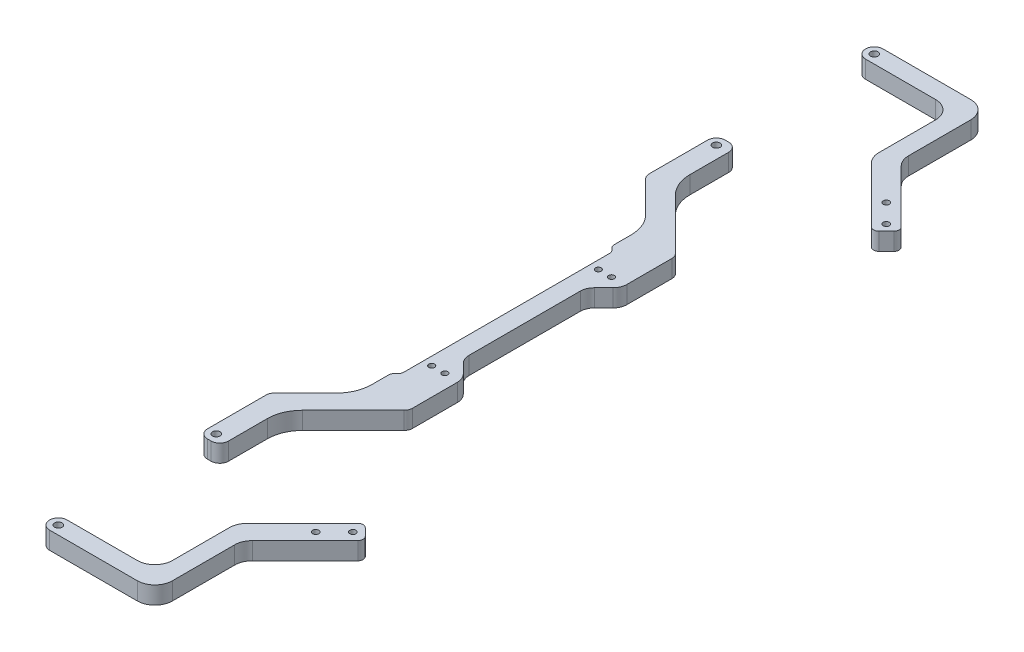
from build123d import *

# Parameters (mm, degrees)
SKETCH_1_R                 = 110
EXTRUDE_1_DEPTH            = 3
SKETCH_2_W                 = 110
SKETCH_2_H                 = 98
CUT_EXTRUDE_1_DEPTH        = 10
SKETCH_3_W                 = 11
SKETCH_3_H                 = 90
CUT_EXTRUDE_2_DEPTH        = 10
SKETCH_4_W                 = 28
SKETCH_4_H                 = 30
CUT_EXTRUDE_3_DEPTH        = 10
FILLET_1_R                 = 2
SKETCH_5_R                 = 2.65
SKETCH_5_R_2               = 1.65
CUT_EXTRUDE_4_DEPTH        = 10
SKETCH_6_W                 = 135
SKETCH_6_H                 = 32
SKETCH_6_W_2               = 32
SKETCH_6_H_2               = 135
CUT_EXTRUDE_5_DEPTH        = 313.909132177
SKETCH_7_W                 = 29
SKETCH_7_H                 = 130
CUT_EXTRUDE_6_DEPTH        = 10
EXTRUDE_2_DEPTH            = 3
SKETCH_12_R                = 1.65
CUT_EXTRUDE_7_DEPTH        = 112
CUT_EXTRUDE_1_2_DEPTH      = 304.514826656
CUT_EXTRUDE_1_2_DEPTH_BACK = 304.514826656
SKETCH_13_W                = 410.5
SKETCH_13_H                = 2
CUT_EXTRUDE_2_2_DEPTH      = 304.514826656
CUT_EXTRUDE_2_2_DEPTH_BACK = 304.514826656
SKETCH_14_W                = 2
SKETCH_14_H                = 410.5
FILLET_2_R                 = 3
FILLET_3_R                 = 3
FILLET_4_R                 = 3
FILLET_5_R                 = 3
FILLET_6_R                 = 3
SKETCH_15_R                = 1.75
CUT_EXTRUDE_8_DEPTH        = 10
SKETCH_16_R                = 1.65
SKETCH_16_R_2              = 2.15
CUT_EXTRUDE_9_DEPTH        = 10
SKETCH_18_R                = 1.65
EXTRUDE_3_DEPTH            = 10
CUT_EXTRUDE_10_DEPTH       = 473.618160963
CUT_EXTRUDE_10_DEPTH_BACK  = 473.618160963
SKETCH_19_W                = 530
SKETCH_19_H                = 40
SKETCH_20_R                = 1.65
EXTRUDE_4_DEPTH            = 10
EXTRUDE_6_DEPTH            = 10
CUT_EXTRUDE_12_DEPTH       = 317.908373021
FILLET_7_R                 = 5
FILLET_8_R                 = 5
SKETCH_25_R                = 1.65
CUT_EXTRUDE_13_DEPTH       = 317.908373021
SKETCH_26_R                = 1.75
EXTRUDE_7_DEPTH            = 10
CUT_EXTRUDE_14_DEPTH       = 10
FILLET_9_R                 = 10
FILLET_13_R                = 20
FILLET_14_R                = 20
CUT_EXTRUDE_16_DEPTH       = 317.908373021
FILLET_15_R                = 8
CUT_EXTRUDE_17_DEPTH       = 317.908373021
FILLET_16_R                = 3
SKETCH_32_W                = 17
SKETCH_32_H                = 60
CUT_EXTRUDE_18_DEPTH       = 317.908373021
FILLET_17_R                = 5
FILLET_18_R                = 5
FILLET_19_R                = 5
SKETCH_33_R                = 2.15
CUT_EXTRUDE_19_DEPTH       = 317.908373021
SKETCH_34_R                = 2.15
EXTRUDE_8_DEPTH            = 10
CUT_EXTRUDE_20_DEPTH       = 10
CUT_EXTRUDE_21_DEPTH       = 10
EXTRUDE_9_DEPTH            = 10
SKETCH_38_R                = 2.15
CUT_EXTRUDE_22_DEPTH       = 10


# Some blends are built 0.0001 mm under size
with BuildPart() as part:
    # 草图1 → 凸台-拉伸1 (new body)
    with BuildSketch(Plane(origin=(0, 0, 0), x_dir=(1, 0, 0), z_dir=(0, 1, 0))):
        Polygon((221.25, -67.5), (221.25, 67.5), (201.200576851, 67.5), (67.5, 201.200576851), (67.5, 221.25), (-67.5, 221.25), (-67.5, 201.200576851), (-201.200576851, 67.5), (-221.25, 67.5), (-221.25, -67.5), (-201.200576851, -67.5), (-67.5, -201.200576851), (-67.5, -221.25), (67.5, -221.25), (67.5, -201.200576851), (201.200576851, -67.5), align=None)
        with Locations(Location((0, 0, 0), (0, 0, 270))):
            Circle(SKETCH_1_R, mode=Mode.SUBTRACT)
    extrude(amount=EXTRUDE_1_DEPTH)

    # 草图2 → Cut-Extrude 1 (cut)
    with BuildSketch(Plane(origin=(0, 3, 0), x_dir=(1, 0, 0), z_dir=(0, 1, 0))):
        with Locations((0, -119)):
            Rectangle(SKETCH_2_W, SKETCH_2_H)
    extrude(amount=-CUT_EXTRUDE_1_DEPTH, mode=Mode.SUBTRACT)

    # 草图3 → Cut-Extrude 2 (cut)
    with BuildSketch(Plane(origin=(0, 3, 0), x_dir=(1, 0, 0), z_dir=(0, 1, 0))):
        with Locations((60.5, -123)):
            Rectangle(SKETCH_3_W, SKETCH_3_H)
    extrude(amount=-CUT_EXTRUDE_2_DEPTH, mode=Mode.SUBTRACT)

    # 草图4 → 切除-拉伸3 (cut)
    with BuildSketch(Plane(origin=(0, 3, 0), x_dir=(1, 0, 0), z_dir=(0, 1, 0))):
        with Locations((10, -168)):
            Rectangle(SKETCH_4_W, SKETCH_4_H)
    extrude(amount=-CUT_EXTRUDE_3_DEPTH, mode=Mode.SUBTRACT)

    # 圆角1
    fillet_1_edges = [part.edges().sort_by_distance(p)[0] for p in [
        (-4, 1.5, 183),
        (221.25, 1.5, -67.5),
        (221.25, 1.5, 67.5),
        (201.200576851, 1.5, 67.5),
        (67.5, 1.5, 201.200576851),
        (67.5, 1.5, 221.25),
        (-67.5, 1.5, 221.25),
        (-67.5, 1.5, 201.200576851),
        (-201.200576851, 1.5, 67.5),
        (-221.25, 1.5, 67.5),
        (-221.25, 1.5, -67.5),
        (-201.200576851, 1.5, -67.5),
        (-67.5, 1.5, -201.200576851),
        (-67.5, 1.5, -221.25),
        (67.5, 1.5, -221.25),
        (67.5, 1.5, -201.200576851),
        (201.200576851, 1.5, -67.5),
        (-55, 1.5, 95.262794416),
        (-55, 1.5, 168),
        (66, 1.5, 88),
        (66, 1.5, 168),
        (-4, 1.5, 168),
        (24, 1.5, 168),
        (24, 1.5, 183),
    ]]
    fillet(fillet_1_edges, radius=FILLET_1_R)

    # 草图5 → 切除-拉伸4 (cut)
    with BuildSketch(Plane(origin=(0, 3, 0), x_dir=(1, 0, 0), z_dir=(0, 1, 0))):
        with Locations(Location((-208.25, 47.5, 0), (0, 0, 270))):
            Circle(SKETCH_5_R)
        with Locations(Location((-197.5, 47.5, 0), (0, 0, 270))):
            Circle(SKETCH_5_R_2)
        with Locations(Location((-190, 47.5, 0), (0, 0, 270))):
            Circle(SKETCH_5_R_2)
        with Locations(Location((-190, -47.5, 0), (0, 0, 270))):
            Circle(SKETCH_5_R_2)
        with Locations(Location((-197.5, -47.5, 0), (0, 0, 270))):
            Circle(SKETCH_5_R_2)
        with Locations(Location((-208.25, -47.5, 0), (0, 0, 270))):
            Circle(SKETCH_5_R)
        with Locations(Location((47.5, 190, 0), (0, 0, 270))):
            Circle(SKETCH_5_R_2)
        with Locations(Location((47.5, 197.5, 0), (0, 0, 270))):
            Circle(SKETCH_5_R_2)
        with Locations(Location((47.5, 208.25, 0), (0, 0, 270))):
            Circle(SKETCH_5_R)
        with Locations(Location((-47.5, 208.25, 0), (0, 0, 270))):
            Circle(SKETCH_5_R)
        with Locations(Location((-47.5, 197.5, 0), (0, 0, 270))):
            Circle(SKETCH_5_R_2)
        with Locations(Location((-47.5, 190, 0), (0, 0, 270))):
            Circle(SKETCH_5_R_2)
        with Locations(Location((190, -47.5, 0), (0, 0, 270))):
            Circle(SKETCH_5_R_2)
        with Locations(Location((197.5, -47.5, 0), (0, 0, 270))):
            Circle(SKETCH_5_R_2)
        with Locations(Location((208.25, -47.5, 0), (0, 0, 270))):
            Circle(SKETCH_5_R)
        with Locations(Location((208.25, 47.5, 0), (0, 0, 270))):
            Circle(SKETCH_5_R)
        with Locations(Location((197.5, 47.5, 0), (0, 0, 270))):
            Circle(SKETCH_5_R_2)
        with Locations(Location((190, 47.5, 0), (0, 0, 270))):
            Circle(SKETCH_5_R_2)
        with Locations(Location((-47.5, -190, 0), (0, 0, 270))):
            Circle(SKETCH_5_R_2)
        with Locations(Location((-47.5, -197.5, 0), (0, 0, 270))):
            Circle(SKETCH_5_R_2)
        with Locations(Location((-47.5, -208.25, 0), (0, 0, 270))):
            Circle(SKETCH_5_R)
        with Locations(Location((47.5, -208.25, 0), (0, 0, 270))):
            Circle(SKETCH_5_R)
        with Locations(Location((47.5, -197.5, 0), (0, 0, 270))):
            Circle(SKETCH_5_R_2)
        with Locations(Location((47.5, -190, 0), (0, 0, 270))):
            Circle(SKETCH_5_R_2)
    extrude(amount=-CUT_EXTRUDE_4_DEPTH, mode=Mode.SUBTRACT)

    # 草图6 → 切除-拉伸5 (cut, through all)
    with BuildSketch(Plane(origin=(0, 3, 0), x_dir=(1, 0, 0), z_dir=(0, 1, 0))):
        with Locations((0, -221.25)):
            Rectangle(SKETCH_6_W, SKETCH_6_H)
        with Locations((-221.25, 0)):
            Rectangle(SKETCH_6_W_2, SKETCH_6_H_2)
        with Locations((221.25, 0)):
            Rectangle(SKETCH_6_W_2, SKETCH_6_H_2)
        with Locations((0, 221.25)):
            Rectangle(SKETCH_6_W, SKETCH_6_H)
    extrude(amount=-CUT_EXTRUDE_5_DEPTH, mode=Mode.SUBTRACT)

    # 草图7 → 切除-拉伸6 (cut)
    with BuildSketch(Plane(origin=(0, 3, 0), x_dir=(1, 0, 0), z_dir=(0, 1, 0))):
        with Locations((155, 0)):
            Rectangle(SKETCH_7_W, SKETCH_7_H)
    extrude(amount=-CUT_EXTRUDE_6_DEPTH, mode=Mode.SUBTRACT)

    # 草图8 → 凸台-拉伸2 (add)
    with BuildSketch(Plane(origin=(0, 3, 0), x_dir=(1, 0, 0), z_dir=(0, 1, 0))):
        Polygon((110.662211256, -214.60690809), (214.60690809, -110.662211256), (199.511809131, -69.18876772), (69.18876772, -199.511809131), align=None)
        Polygon((214.60690809, 110.662211256), (199.511809131, 69.18876772), (69.18876772, 199.511809131), (110.662211256, 214.60690809), align=None)
        Polygon((-214.60690809, -110.662211256), (-199.511809131, -69.18876772), (-69.18876772, -199.511809131), (-110.662211256, -214.60690809), align=None)
        Polygon((-110.662211256, 214.60690809), (-214.60690809, 110.662211256), (-199.511809131, 69.18876772), (-69.18876772, 199.511809131), align=None)
    extrude(amount=-EXTRUDE_2_DEPTH)

    # 草图12 → 切除-拉伸7 (cut)
    with BuildSketch(Plane(origin=(0, 3, 0), x_dir=(1, 0, 0), z_dir=(0, 1, 0))):
        with Locations(Location((162.634559673, -148.492424049, 0), (0, 0, 270))):
            Circle(SKETCH_12_R)
        with Locations(Location((152.027957955, -137.885822331, 0), (0, 0, 270))):
            Circle(SKETCH_12_R)
        with Locations(Location((137.885822331, -152.027957955, 0), (0, 0, 270))):
            Circle(SKETCH_12_R)
        with Locations(Location((148.492424049, -162.634559673, 0), (0, 0, 270))):
            Circle(SKETCH_12_R)
        with Locations(Location((148.492424049, 162.634559673, 0), (0, 0, 270))):
            Circle(SKETCH_12_R)
        with Locations(Location((137.885822331, 152.027957955, 0), (0, 0, 270))):
            Circle(SKETCH_12_R)
        with Locations(Location((152.027957955, 137.885822331, 0), (0, 0, 270))):
            Circle(SKETCH_12_R)
        with Locations(Location((162.634559673, 148.492424049, 0), (0, 0, 270))):
            Circle(SKETCH_12_R)
        with Locations(Location((-148.492424049, -162.634559673, 0), (0, 0, 270))):
            Circle(SKETCH_12_R)
        with Locations(Location((-137.885822331, -152.027957955, 0), (0, 0, 270))):
            Circle(SKETCH_12_R)
        with Locations(Location((-152.027957955, -137.885822331, 0), (0, 0, 270))):
            Circle(SKETCH_12_R)
        with Locations(Location((-162.634559673, -148.492424049, 0), (0, 0, 270))):
            Circle(SKETCH_12_R)
        with Locations(Location((-162.634559673, 148.492424049, 0), (0, 0, 270))):
            Circle(SKETCH_12_R)
        with Locations(Location((-152.027957955, 137.885822331, 0), (0, 0, 270))):
            Circle(SKETCH_12_R)
        with Locations(Location((-137.885822331, 152.027957955, 0), (0, 0, 270))):
            Circle(SKETCH_12_R)
        with Locations(Location((-148.492424049, 162.634559673, 0), (0, 0, 270))):
            Circle(SKETCH_12_R)
    extrude(amount=-CUT_EXTRUDE_7_DEPTH, mode=Mode.SUBTRACT)

    # 草图13 → Cut-Extrude 1 2 (cut, two sides: drawn at the far end of the back side and taken through both)
    with BuildSketch(Plane(origin=(0, 3, 0), x_dir=(1, 0, 0), z_dir=(0, 1, 0)).offset(-CUT_EXTRUDE_1_2_DEPTH_BACK)):
        Rectangle(SKETCH_13_W, SKETCH_13_H)
    extrude(amount=CUT_EXTRUDE_1_2_DEPTH + CUT_EXTRUDE_1_2_DEPTH_BACK, mode=Mode.SUBTRACT)


with BuildPart() as cut_extrude_1_2_piece_1:
    # of the separate pieces the step leaves, piece 1, a body of its own (cut_extrude_1_2_pieces)
    add(part.part.solids().sort_by_distance((169.5, 0, -1))[0])


with BuildPart() as cut_extrude_1_2_piece_2:
    # of the separate pieces the step leaves, piece 2, a body of its own (cut_extrude_1_2_pieces)
    add(part.part.solids().sort_by_distance((202.029003976, 0, 67.5))[0])


with BuildPart() as cut_extrude_2_2_tool:
    # 草图14 → Cut-Extrude 2 2 (new, two sides: drawn at the far end of the back side and taken through both)
    with BuildSketch(Plane(origin=(0, 3, 0), x_dir=(1, 0, 0), z_dir=(0, 1, 0)).offset(-CUT_EXTRUDE_2_2_DEPTH_BACK)):
        Rectangle(SKETCH_14_W, SKETCH_14_H)
    extrude(amount=CUT_EXTRUDE_2_2_DEPTH + CUT_EXTRUDE_2_2_DEPTH_BACK)


with BuildPart() as cut_extrude_1_2_piece_1_1:
    add(cut_extrude_1_2_piece_1.part)

    # Cut-Extrude 2 2: cut by cut_extrude_2_2_tool
    add(cut_extrude_2_2_tool.part, mode=Mode.SUBTRACT)


with BuildPart() as cut_extrude_1_2_piece_2_1:
    add(cut_extrude_1_2_piece_2.part)

    # Cut-Extrude 2 2: cut by cut_extrude_2_2_tool
    add(cut_extrude_2_2_tool.part, mode=Mode.SUBTRACT)


with BuildPart() as cut_extrude_2_2_piece_1:
    # of the separate pieces the step leaves, piece 1, a body of its own (cut_extrude_2_2_pieces)
    add(cut_extrude_1_2_piece_1_1.part.solids().sort_by_distance((-1, 0, -109.995454452))[0])

    # 圆角5
    # the kernel refuses this fillet: 3 mm, written as the material it adds along each edge
    with BuildSketch(Plane(origin=(-69.18876772, 3, -199.511809131), x_dir=(-0.9396926207859093, 0, -0.3420201433256662), z_dir=(0, -1, 0))) as fillet_5_piece_1:
        with BuildLine():
            CenterArc((1.887083369, 3), FILLET_5_R, 211.922044532, 58.077955468)
            Line((-0.659221556, 1.413705188), (0, 0))
            Line((0, 0), (1.887083369, 0))
        make_face()
    extrude(amount=3)
    with BuildSketch(Plane(origin=(-199.511809131, 3, -69.18876772), x_dir=(-0.7071067811865065, 0, 0.7071067811865885), z_dir=(0, -1, 0))) as fillet_5_piece_2:
        with BuildLine():
            CenterArc((1.921407468, 2.978133138), FILLET_5_R, 205, 58.077955468)
            Line((-0.797515893, 1.710278352), (0, 0))
            Line((0, 0), (1.559851089, 0))
        make_face()
    extrude(amount=3)
    # the kernel refuses this fillet: 3 mm, written as the material it takes off along each edge
    with BuildSketch(Plane(origin=(-67.5, 10.5, -205.25), x_dir=(0, 0, 1), z_dir=(0, -1, 0)), Plane(origin=(-205.25, 10.5, -67.5), x_dir=(0, 0, 1), z_dir=(0, -1, 0)), Plane(origin=(-205.25, 10.5, -1), x_dir=(1, 0, 0), z_dir=(0, -1, 0)), Plane(origin=(-1, 10.5, -205.25), x_dir=(-1, 0, 0), z_dir=(0, -1, 0))) as fillet_5_2_piece_1:
        with BuildLine():
            CenterArc((FILLET_5_R, -FILLET_5_R), FILLET_5_R, 90, 90)
            Line((0, -FILLET_5_R), (0, 0))
            Line((0, 0), (FILLET_5_R, 0))
        make_face()
    extrude(amount=18, mode=Mode.SUBTRACT)
    with BuildSketch(Plane(origin=(-110.662211256, 7.778026956, -214.60690809), x_dir=(-0.7071067811865476, 0, 0.7071067811865476), z_dir=(0, -1, 0)), Plane(origin=(-214.60690809, 7.778026956, -110.662211256), x_dir=(0.34202014332566893, 0, 0.9396926207859083), z_dir=(0, -1, 0))) as fillet_5_2_piece_2:
        with BuildLine():
            CenterArc((FILLET_5_R * 0.637070260807, -FILLET_5_R), FILLET_5_R, 90, 65)
            Line((-FILLET_5_R * 0.269237526229, -FILLET_5_R * 0.577381738259), (0, 0))
            Line((0, 0), (FILLET_5_R * 0.637070260807, 0))
        make_face()
    extrude(amount=12.556053912, mode=Mode.SUBTRACT)
    with BuildSketch(Plane(origin=(-109.995454452, 10.334317242, -1), x_dir=(0.022246495156751204, 0, -0.9997525161024806), z_dir=(0, -1, 0))) as fillet_5_2_piece_3:
        with BuildLine():
            CenterArc((2.933992407, -2.999740332), FILLET_5_R, 90.753857544, 87.971407014)
            Line((-0.065265141, -2.933000847), (0, 0))
            ThreePointArc((0, 0), (1.447260829, -0.009521157), (2.894521657, 0))
        make_face()
    extrude(amount=17.668634484, mode=Mode.SUBTRACT)
    with BuildSketch(Plane(origin=(-1, 10.334317242, -109.995454452), x_dir=(-0.9997525161024806, 0, 0.02224649515675109), z_dir=(0, -1, 0))) as fillet_5_2_piece_4:
        with BuildLine():
            CenterArc((2.933992407, 2.999740332), FILLET_5_R, 181.274735442, 87.971407014)
            Line((-0.065265141, 2.933000847), (0, 0))
            ThreePointArc((0, 0), (1.447260829, 0.009521157), (2.894521657, 0))
        make_face()
    extrude(amount=17.668634484, mode=Mode.SUBTRACT)


with BuildPart() as cut_extrude_2_2_piece_2:
    # of the separate pieces the step leaves, piece 2, a body of its own (cut_extrude_2_2_pieces)
    add(cut_extrude_1_2_piece_1_1.part.solids().sort_by_distance((169.5, 0, -65))[0])

    # 圆角4
    # the kernel refuses this fillet: 3 mm, written as the material it adds along each edge
    with BuildSketch(Plane(origin=(69.18876772, 3, -199.511809131), x_dir=(-0.7071067811865521, 0, -0.7071067811865429), z_dir=(0, -1, 0))) as fillet_4_piece_1:
        with BuildLine():
            CenterArc((1.921407468, 2.978133138), FILLET_4_R, 205, 58.077955468)
            Line((-0.797515893, 1.710278352), (0, 0))
            Line((0, 0), (1.559851089, 0))
        make_face()
    extrude(amount=3)
    with BuildSketch(Plane(origin=(169.5, 3, -65), x_dir=(0, 0, 1), z_dir=(0, -1, 0)), Plane(origin=(140.5, 3, -65), x_dir=(1, 0, 0), z_dir=(0, -1, 0))) as fillet_4_piece_2:
        with BuildLine():
            CenterArc((FILLET_4_R, FILLET_4_R), FILLET_4_R, 180, 90)
            Line((0, FILLET_4_R), (0, 0))
            Line((0, 0), (FILLET_4_R, 0))
        make_face()
    extrude(amount=3)
    # the kernel refuses this fillet: 3 mm, written as the material it takes off along each edge
    with BuildSketch(Plane(origin=(1, 10.334317242, -109.995454452), x_dir=(0.9997525161024806, 0, 0.022246495156751034), z_dir=(0, -1, 0))) as fillet_4_2_piece_1:
        with BuildLine():
            CenterArc((2.933992407, -2.999740332), FILLET_4_R, 90.753857544, 87.971407014)
            Line((-0.065265141, -2.933000847), (0, 0))
            ThreePointArc((0, 0), (1.447260829, -0.009521157), (2.894521657, 0))
        make_face()
    extrude(amount=17.668634484, mode=Mode.SUBTRACT)
    with BuildSketch(Plane(origin=(1, 10.5, -205.25), x_dir=(0, 0, 1), z_dir=(0, -1, 0)), Plane(origin=(67.5, 10.5, -205.25), x_dir=(-1, 0, 0), z_dir=(0, -1, 0)), Plane(origin=(205.25, 10.5, -67.5), x_dir=(-1, 0, 0), z_dir=(0, -1, 0)), Plane(origin=(140.5, 10.5, -1), x_dir=(0, 0, -1), z_dir=(0, -1, 0)), Plane(origin=(169.5, -7.5, -1), x_dir=(0, 0, -1), z_dir=(0, 1, 0))) as fillet_4_2_piece_2:
        with BuildLine():
            CenterArc((FILLET_4_R, -FILLET_4_R), FILLET_4_R, 90, 90)
            Line((0, -FILLET_4_R), (0, 0))
            Line((0, 0), (FILLET_4_R, 0))
        make_face()
    extrude(amount=18, mode=Mode.SUBTRACT)
    with BuildSketch(Plane(origin=(110.662211256, 7.778026956, -214.60690809), x_dir=(-0.9396926207859083, 0, 0.34202014332566893), z_dir=(0, -1, 0)), Plane(origin=(214.60690809, 7.778026956, -110.662211256), x_dir=(-0.7071067811865476, 0, -0.7071067811865476), z_dir=(0, -1, 0))) as fillet_4_2_piece_3:
        with BuildLine():
            CenterArc((FILLET_4_R * 0.637070260807, -FILLET_4_R), FILLET_4_R, 90, 65)
            Line((-FILLET_4_R * 0.269237526229, -FILLET_4_R * 0.577381738259), (0, 0))
            Line((0, 0), (FILLET_4_R * 0.637070260808, 0))
        make_face()
    extrude(amount=12.556053912, mode=Mode.SUBTRACT)
    with BuildSketch(Plane(origin=(109.995454452, 10.334317242, -1), x_dir=(1, 0, 0), z_dir=(0, -1, 0))) as fillet_4_2_piece_4:
        with BuildLine():
            CenterArc((2.933726897, -3), FILLET_4_R, 90, 87.971407014)
            ThreePointArc((-0.064392962, -2.89380531), (-0.02267768, -1.447114467), (0, 0))
            Line((0, 0), (2.933726897, 0))
        make_face()
    extrude(amount=17.668634484, mode=Mode.SUBTRACT)
    with BuildSketch(Plane(origin=(205.25, -7.5, -1), x_dir=(0, 0, -1), z_dir=(0, 1, 0))) as fillet_4_2_piece_5:
        with BuildLine():
            CenterArc((FILLET_4_R, FILLET_4_R), FILLET_4_R, 180, 90)
            Line((0, FILLET_4_R), (0, 0))
            Line((0, 0), (FILLET_4_R, 0))
        make_face()
    extrude(amount=18, mode=Mode.SUBTRACT)


with BuildPart() as cut_extrude_2_2_piece_1_of_cut_extrude_1:
    # of the separate pieces the step leaves, piece 1, a body of its own (cut_extrude_2_2_pieces_of_cut_extrude_1)
    add(cut_extrude_1_2_piece_2_1.part.solids().sort_by_distance((-1, 0, 205.25))[0])

    # 圆角2
    # the kernel refuses this fillet: 3 mm, written as the material it adds along each edge
    with BuildSketch(Plane(origin=(-69.18876772, 3, 199.511809131), x_dir=(0.7071067811865567, 0, 0.7071067811865385), z_dir=(0, -1, 0))) as fillet_2_piece_1:
        with BuildLine():
            CenterArc((1.921407468, 2.978133138), FILLET_2_R, 205, 58.077955468)
            Line((-0.797515893, 1.710278352), (0, 0))
            Line((0, 0), (1.559851089, 0))
        make_face()
    extrude(amount=3)
    with BuildSketch(Plane(origin=(-199.511809131, 3, 69.18876772), x_dir=(-0.34202014332567227, 0, 0.9396926207859071), z_dir=(0, -1, 0))) as fillet_2_piece_2:
        with BuildLine():
            CenterArc((1.887083369, 3), FILLET_2_R, 211.922044532, 58.077955468)
            Line((-0.659221556, 1.413705188), (0, 0))
            Line((0, 0), (1.887083369, 0))
        make_face()
    extrude(amount=3)
    # the kernel refuses this fillet: 3 mm, written as the material it takes off along each edge
    with BuildSketch(Plane(origin=(-1, -7.5, 205.25), x_dir=(-1, 0, 0), z_dir=(0, 1, 0)), Plane(origin=(-67.5, 10.5, 205.25), x_dir=(1, 0, 0), z_dir=(0, -1, 0)), Plane(origin=(-205.25, 10.5, 1), x_dir=(0, 0, 1), z_dir=(0, -1, 0)), Plane(origin=(-205.25, 10.5, 67.5), x_dir=(1, 0, 0), z_dir=(0, -1, 0))) as fillet_2_2_piece_1:
        with BuildLine():
            CenterArc((FILLET_2_R, -FILLET_2_R), FILLET_2_R, 90, 90)
            Line((0, -FILLET_2_R), (0, 0))
            Line((0, 0), (FILLET_2_R, 0))
        make_face()
    extrude(amount=18, mode=Mode.SUBTRACT)
    with BuildSketch(Plane(origin=(-214.60690809, 7.778026956, 110.662211256), x_dir=(0.7071067811865476, 0, 0.7071067811865476), z_dir=(0, -1, 0)), Plane(origin=(-110.662211256, 7.778026956, 214.60690809), x_dir=(0.9396926207859083, 0, -0.34202014332566893), z_dir=(0, -1, 0))) as fillet_2_2_piece_2:
        with BuildLine():
            CenterArc((FILLET_2_R * 0.637070260807, -FILLET_2_R), FILLET_2_R, 90, 65)
            Line((-FILLET_2_R * 0.269237526229, -FILLET_2_R * 0.577381738259), (0, 0))
            Line((0, 0), (FILLET_2_R * 0.637070260807, 0))
        make_face()
    extrude(amount=12.556053912, mode=Mode.SUBTRACT)

    # 圆角6
    fillet_6_edges = [cut_extrude_2_2_piece_1_of_cut_extrude_1.edges().sort_by_distance(p)[0] for p in [
        (-1, 1.5, 183),
        (-109.995454452, 1.5, 1),
    ]]
    fillet(fillet_6_edges, radius=FILLET_6_R)


with BuildPart() as cut_extrude_2_2_piece_2_of_cut_extrude_1:
    # of the separate pieces the step leaves, piece 2, a body of its own (cut_extrude_2_2_pieces_of_cut_extrude_1)
    add(cut_extrude_1_2_piece_2_1.part.solids().sort_by_distance((202.029003976, 0, 67.5))[0])

    # 圆角3
    # the kernel refuses this fillet: 3 mm, written as the material it adds along each edge
    with BuildSketch(Plane(origin=(169.5, 3, 65), x_dir=(-1, 0, 0), z_dir=(0, -1, 0)), Plane(origin=(140.5, 3, 65), x_dir=(0, 0, -1), z_dir=(0, -1, 0))) as fillet_3_piece_1:
        with BuildLine():
            CenterArc((FILLET_3_R, FILLET_3_R), FILLET_3_R, 180, 90)
            Line((0, FILLET_3_R), (0, 0))
            Line((0, 0), (FILLET_3_R, 0))
        make_face()
    extrude(amount=3)
    with BuildSketch(Plane(origin=(199.511809131, 3, 69.18876772), x_dir=(0.7071067811865385, 0, -0.7071067811865567), z_dir=(0, -1, 0))) as fillet_3_piece_2:
        with BuildLine():
            CenterArc((1.921407468, 2.978133138), FILLET_3_R, 205, 58.077955468)
            Line((-0.797515893, 1.710278352), (0, 0))
            Line((0, 0), (1.559851089, 0))
        make_face()
    extrude(amount=3)
    with BuildSketch(Plane(origin=(69.18876772, 3, 199.511809131), x_dir=(0.9396926207859093, 0, 0.3420201433256662), z_dir=(0, -1, 0))) as fillet_3_piece_3:
        with BuildLine():
            CenterArc((1.887083369, 3), FILLET_3_R, 211.922044532, 58.077955468)
            Line((-0.659221556, 1.413705188), (0, 0))
            Line((0, 0), (1.887083369, 0))
        make_face()
    extrude(amount=3)
    # the kernel refuses this fillet: 3 mm, written as the material it takes off along each edge
    with BuildSketch(Plane(origin=(109.995454452, 10.334317242, 1), x_dir=(-0.02224649515675097, 0, 0.9997525161024806), z_dir=(0, -1, 0))) as fillet_3_2_piece_1:
        with BuildLine():
            CenterArc((2.933992407, -2.999740332), FILLET_3_R, 90.753857544, 87.971407014)
            Line((-0.065265141, -2.933000847), (0, 0))
            ThreePointArc((0, 0), (1.447260829, -0.009521157), (2.894521657, 0))
        make_face()
    extrude(amount=17.668634484, mode=Mode.SUBTRACT)
    with BuildSketch(Plane(origin=(140.5, -7.5, 1), x_dir=(-1, 0, 0), z_dir=(0, 1, 0)), Plane(origin=(205.25, -7.5, 1), x_dir=(-1, 0, 0), z_dir=(0, 1, 0)), Plane(origin=(1, -7.5, 183), x_dir=(0, 0, 1), z_dir=(0, 1, 0)), Plane(origin=(1, -7.5, 205.25), x_dir=(1, 0, 0), z_dir=(0, 1, 0))) as fillet_3_2_piece_2:
        with BuildLine():
            CenterArc((FILLET_3_R, FILLET_3_R), FILLET_3_R, 180, 90)
            Line((0, FILLET_3_R), (0, 0))
            Line((0, 0), (FILLET_3_R, 0))
        make_face()
    extrude(amount=18, mode=Mode.SUBTRACT)
    with BuildSketch(Plane(origin=(169.5, 10.5, 1), x_dir=(0, 0, 1), z_dir=(0, -1, 0)), Plane(origin=(205.25, 10.5, 67.5), x_dir=(0, 0, -1), z_dir=(0, -1, 0)), Plane(origin=(67.5, 10.5, 205.25), x_dir=(0, 0, -1), z_dir=(0, -1, 0))) as fillet_3_2_piece_3:
        with BuildLine():
            CenterArc((FILLET_3_R, -FILLET_3_R), FILLET_3_R, 90, 90)
            Line((0, -FILLET_3_R), (0, 0))
            Line((0, 0), (FILLET_3_R, 0))
        make_face()
    extrude(amount=18, mode=Mode.SUBTRACT)
    with BuildSketch(Plane(origin=(214.60690809, 7.778026956, 110.662211256), x_dir=(-0.34202014332566893, 0, -0.9396926207859083), z_dir=(0, -1, 0)), Plane(origin=(110.662211256, 7.778026956, 214.60690809), x_dir=(0.7071067811865476, 0, -0.7071067811865476), z_dir=(0, -1, 0))) as fillet_3_2_piece_4:
        with BuildLine():
            CenterArc((FILLET_3_R * 0.637070260807, -FILLET_3_R), FILLET_3_R, 90, 65)
            Line((-FILLET_3_R * 0.269237526229, -FILLET_3_R * 0.577381738259), (0, 0))
            Line((0, 0), (FILLET_3_R * 0.637070260808, 0))
        make_face()
    extrude(amount=12.556053912, mode=Mode.SUBTRACT)


with BuildPart() as cut_extrude_8_tool:
    # 草图15 → 切除-拉伸8 (new body)
    with BuildSketch(Plane.XZ):
        with Locations(Location((106.066017178, -205.060966544, 0), (0, 0, 270))):
            Circle(SKETCH_15_R)
        with Locations(Location((91.923881554, -190.91883092, 0), (0, 0, 270))):
            Circle(SKETCH_15_R)
        with Locations(Location((190.91883092, -91.923881554, 0), (0, 0, 90))):
            Circle(SKETCH_15_R)
        with Locations(Location((205.060966544, -106.066017178, 0), (0, 0, 90))):
            Circle(SKETCH_15_R)
        with Locations(Location((-205.060966544, -106.066017178, 0), (0, 0, 270))):
            Circle(SKETCH_15_R)
        with Locations(Location((-190.91883092, -91.923881554, 0), (0, 0, 270))):
            Circle(SKETCH_15_R)
        with Locations(Location((-91.923881554, -190.91883092, 0), (0, 0, 90))):
            Circle(SKETCH_15_R)
        with Locations(Location((-106.066017178, -205.060966544, 0), (0, 0, 90))):
            Circle(SKETCH_15_R)
        with Locations(Location((-106.066017178, 205.060966544, 0), (0, 0, 270))):
            Circle(SKETCH_15_R)
        with Locations(Location((-91.923881554, 190.91883092, 0), (0, 0, 270))):
            Circle(SKETCH_15_R)
        with Locations(Location((-190.91883092, 91.923881554, 0), (0, 0, 90))):
            Circle(SKETCH_15_R)
        with Locations(Location((-205.060966544, 106.066017178, 0), (0, 0, 90))):
            Circle(SKETCH_15_R)
        with Locations(Location((205.060966544, 106.066017178, 0), (0, 0, 270))):
            Circle(SKETCH_15_R)
        with Locations(Location((190.91883092, 91.923881554, 0), (0, 0, 270))):
            Circle(SKETCH_15_R)
        with Locations(Location((91.923881554, 190.91883092, 0), (0, 0, 90))):
            Circle(SKETCH_15_R)
        with Locations(Location((106.066017178, 205.060966544, 0), (0, 0, 90))):
            Circle(SKETCH_15_R)
    extrude(amount=-CUT_EXTRUDE_8_DEPTH)


with BuildPart() as cut_extrude_2_2_piece_1_1:
    add(cut_extrude_2_2_piece_1.part)

    # 切除-拉伸8: cut by cut_extrude_8_tool
    add(cut_extrude_8_tool.part, mode=Mode.SUBTRACT)

    # 草图16 → 切除-拉伸9 (cut)
    with BuildSketch(Plane(origin=(0, 3, 0), x_dir=(1, 0, 0), z_dir=(0, 1, 0))):
        with Locations(Location((-118.793939239, 149.906637612, 0), (0, 0, 270))):
            Circle(SKETCH_16_R)
        with Locations(Location((-71.77133829, 117.733279068, 0), (0, 0, 270))):
            Circle(SKETCH_16_R_2)
        with Locations(Location((-117.733279068, 71.77133829, 0), (0, 0, 270))):
            Circle(SKETCH_16_R_2)
        with Locations(Location((-149.906637612, 118.793939239, 0), (0, 0, 270))):
            Circle(SKETCH_16_R)
    extrude(amount=-CUT_EXTRUDE_9_DEPTH, mode=Mode.SUBTRACT)



with BuildPart() as cut_extrude_2_2_piece_2_1:
    add(cut_extrude_2_2_piece_2.part)

    # 切除-拉伸8: cut by cut_extrude_8_tool
    add(cut_extrude_8_tool.part, mode=Mode.SUBTRACT)


with BuildPart() as cut_extrude_2_2_piece_1_of_cut_extrude_1_1:
    add(cut_extrude_2_2_piece_1_of_cut_extrude_1.part)

    # 切除-拉伸8: cut by cut_extrude_8_tool
    add(cut_extrude_8_tool.part, mode=Mode.SUBTRACT)


with BuildPart() as cut_extrude_2_2_piece_2_of_cut_extrude_1_1:
    add(cut_extrude_2_2_piece_2_of_cut_extrude_1.part)

    # 切除-拉伸8: cut by cut_extrude_8_tool
    add(cut_extrude_8_tool.part, mode=Mode.SUBTRACT)


with BuildPart() as cut_extrude_2_2_piece_1_2:
    add(cut_extrude_2_2_piece_1_1.part)

    add(cut_extrude_2_2_piece_1_of_cut_extrude_1_1.part)  # 凸台-拉伸3 merges Cut-Extrude 2 2 piece 1 of Cut-Extrude 1
    # 草图18 → 凸台-拉伸3 (add)
    with BuildSketch(Plane(origin=(0, 3, 0), x_dir=(1, 0, 0), z_dir=(0, 1, 0))):
        with BuildLine():
            Line((-182, -75.933982822), (-182, 75.933982822))
            Line((-182, 75.933982822), (-218.25, 112.183982822))
            Line((-218.25, 112.183982822), (-218.25, 188.379942315))
            ThreePointArc((-218.25, 188.379942315), (-216.398050297, 191.151580912), (-213.128679656, 190.501262658))
            Line((-213.128679656, 190.501262658), (-152.735064736, 130.107647738))
            Line((-152.735064736, 130.107647738), (-144.249783362, 138.592929113))
            Line((-144.249783362, 138.592929113), (-221.714466094, 216.057611845))
            ThreePointArc((-221.714466094, 216.057611845), (-227.163417162, 217.141475601), (-230.25, 212.522077939))
            Line((-230.25, 212.522077939), (-230.25, 107.213420074))
            Line((-230.25, 107.213420074), (-205.25, 82.213420074))
            Line((-205.25, 82.213420074), (-205.25, -82.213420074))
            Line((-205.25, -82.213420074), (-230.25, -107.213420074))
            Line((-230.25, -107.213420074), (-230.25, -212.522077939))
            ThreePointArc((-230.25, -212.522077939), (-227.163417162, -217.141475601), (-221.714466094, -216.057611845))
            Line((-221.714466094, -216.057611845), (-144.249783362, -138.592929113))
            Line((-144.249783362, -138.592929113), (-152.735064736, -130.107647738))
            Line((-152.735064736, -130.107647738), (-213.128679656, -190.501262658))
            ThreePointArc((-213.128679656, -190.501262658), (-216.398050297, -191.151580912), (-218.25, -188.379942315))
            Line((-218.25, -188.379942315), (-218.25, -112.183982822))
            Line((-218.25, -112.183982822), (-182, -75.933982822))
        make_face()
        with Locations(Location((-190, 47.5, 0), (0, 0, 270))):
            Circle(SKETCH_18_R, mode=Mode.SUBTRACT)
        with Locations(Location((-197.5, 47.5, 0), (0, 0, 270))):
            Circle(SKETCH_18_R, mode=Mode.SUBTRACT)
        with Locations(Location((-197.5, -47.5, 0), (0, 0, 270))):
            Circle(SKETCH_18_R, mode=Mode.SUBTRACT)
        with Locations(Location((-190, -47.5, 0), (0, 0, 270))):
            Circle(SKETCH_18_R, mode=Mode.SUBTRACT)
        with Locations(Location((-152.027957955, -137.885822331, 0), (0, 0, 270))):
            Circle(SKETCH_18_R, mode=Mode.SUBTRACT)
        with Locations(Location((-162.634559673, -148.492424049, 0), (0, 0, 270))):
            Circle(SKETCH_18_R, mode=Mode.SUBTRACT)
        with Locations(Location((-152.027957955, 137.885822331, 0), (0, 0, 270))):
            Circle(SKETCH_18_R, mode=Mode.SUBTRACT)
        with Locations(Location((-162.634559673, 148.492424049, 0), (0, 0, 270))):
            Circle(SKETCH_18_R, mode=Mode.SUBTRACT)
    extrude(amount=EXTRUDE_3_DEPTH)


with BuildPart() as cut_extrude_10_tool:
    # 草图19 → 切除-拉伸10 (new, two sides: drawn at the far end of the back side and taken through both)
    with BuildSketch(Plane.ZY.offset(205.25).offset(-CUT_EXTRUDE_10_DEPTH_BACK)):
        with Locations((19.540360843, -17)):
            Rectangle(SKETCH_19_W, SKETCH_19_H)
    extrude(amount=CUT_EXTRUDE_10_DEPTH + CUT_EXTRUDE_10_DEPTH_BACK)


with BuildPart() as cut_extrude_2_2_piece_1_3:
    add(cut_extrude_2_2_piece_1_2.part)

    # 切除-拉伸10: cut by cut_extrude_10_tool
    add(cut_extrude_10_tool.part, mode=Mode.SUBTRACT)

    # 草图20 → 凸台-拉伸4 (add)
    with BuildSketch(Plane(origin=(0, 13, 0), x_dir=(1, 0, 0), z_dir=(0, 1, 0))):
        with Locations((-152.027957955, 137.885822331)):
            Circle(SKETCH_20_R)
        with Locations((-162.634559673, 148.492424049)):
            Circle(SKETCH_20_R)
    extrude(amount=-EXTRUDE_4_DEPTH)

    # 草图23 → 凸台-拉伸6 (add)
    with BuildSketch(Plane(origin=(0, 13, 0), x_dir=(1, 0, 0), z_dir=(0, 1, 0))):
        with BuildLine():
            Line((-175.25, 217.522077939), (-225.25, 217.522077939))
            ThreePointArc((-225.25, 217.522077939), (-223.336582838, 217.141475601), (-221.714466094, 216.057611845))
            Line((-221.714466094, 216.057611845), (-213.178932188, 207.522077939))
            Line((-213.178932188, 207.522077939), (-185.25, 207.522077939))
            ThreePointArc((-185.25, 207.522077939), (-178.178932188, 204.593145751), (-175.25, 197.522077939))
            Line((-175.25, 197.522077939), (-175.25, 169.593145751))
            Line((-175.25, 169.593145751), (-165.25, 159.593145751))
            Line((-165.25, 159.593145751), (-165.25, 207.522077939))
            ThreePointArc((-165.25, 207.522077939), (-168.178932188, 214.593145751), (-175.25, 217.522077939))
        make_face()
    extrude_6 = extrude(amount=-EXTRUDE_6_DEPTH)

    # 草图24 → 切除-拉伸12 (cut, through all)
    with BuildSketch(Plane.XZ.offset(-3)):
        Polygon((-218.25, -188.379942315), (-218.25, -207.522077939), (-213.178932188, -207.522077939), (-175.25, -169.593145751), (-175.25, -152.622583002), align=None)
    cut_extrude_12 = extrude(amount=-CUT_EXTRUDE_12_DEPTH, mode=Mode.SUBTRACT)

    # 镜向1: 凸台-拉伸6, 切除-拉伸12 across plane
    add(extrude_6.mirror(Plane.XY))
    add(cut_extrude_12.mirror(Plane.XY), mode=Mode.SUBTRACT)

    # 圆角7
    fillet_7_edges = [cut_extrude_2_2_piece_1_3.edges().sort_by_distance(p)[0] for p in [
        (-218.25, 8, -207.522077939),
        (-218.25, 8, 207.522077939),
    ]]
    fillet(fillet_7_edges, radius=FILLET_7_R)

    # 圆角8
    fillet_8_edges = [cut_extrude_2_2_piece_1_3.edges().sort_by_distance(p)[0] for p in [
        (-230.25, 8, 107.213420074),
        (-144.249783362, 8, 138.592929113),
        (-152.735064736, 8, 130.107647738),
        (-182, 8, 75.933982822),
        (-182, 8, -75.933982822),
        (-152.735064736, 8, -130.107647738),
        (-144.249783362, 8, -138.592929113),
        (-230.25, 8, -107.213420074),
        (-175.25, 8, -152.622583002),
        (-175.25, 8, 152.622583002),
    ]]
    fillet(fillet_8_edges, radius=FILLET_8_R)

    # 草图25 → 切除-拉伸13 (cut, through all)
    with BuildSketch(Plane(origin=(0, 13, 0), x_dir=(1, 0, 0), z_dir=(0, 1, 0))):
        with Locations(Location((-152.027957955, 137.885822331, 0), (0, 0, 270))):
            Circle(SKETCH_25_R)
        with Locations(Location((-162.634559673, 148.492424049, 0), (0, 0, 270))):
            Circle(SKETCH_25_R)
    extrude(amount=-CUT_EXTRUDE_13_DEPTH, mode=Mode.SUBTRACT)

    # 草图26 → 凸台-拉伸7 (add)
    # profile 1 of 2: a face of its own
    with BuildSketch(Plane(origin=(0, 13, 0), x_dir=(1, 0, 0), z_dir=(0, 1, 0))):
        with BuildLine():
            Line((-140.714249456, 146.371103706), (-165.25, 170.906854249))
            Line((-165.25, 170.906854249), (-165.25, 187.877416998))
            Line((-165.25, 187.877416998), (-132.228968082, 154.85638508))
            ThreePointArc((-132.228968082, 154.85638508), (-131.350288425, 152.735064736), (-132.228968082, 150.613744393))
            Line((-132.228968082, 150.613744393), (-136.471608769, 146.371103706))
            ThreePointArc((-136.471608769, 146.371103706), (-138.592929113, 145.492424049), (-140.714249456, 146.371103706))
        make_face()
        with Locations(Location((-137.885822331, 152.027957955, 0), (0, 0, 270))):
            Circle(SKETCH_26_R, mode=Mode.SUBTRACT)
        with Locations(Location((-148.492424049, 162.634559673, 0), (0, 0, 270))):
            Circle(SKETCH_26_R, mode=Mode.SUBTRACT)
    # profile 2 of 2: a face of its own
    with BuildSketch(Plane(origin=(0, 13, 0), x_dir=(1, 0, 0), z_dir=(0, 1, 0))):
        with BuildLine():
            Line((-132.228968082, -154.85638508), (-165.25, -187.877416998))
            Line((-165.25, -187.877416998), (-165.25, -170.906854249))
            Line((-165.25, -170.906854249), (-140.714249456, -146.371103706))
            ThreePointArc((-140.714249456, -146.371103706), (-138.592929113, -145.492424049), (-136.471608769, -146.371103706))
            Line((-136.471608769, -146.371103706), (-132.228968082, -150.613744393))
            ThreePointArc((-132.228968082, -150.613744393), (-131.350288425, -152.735064736), (-132.228968082, -154.85638508))
        make_face()
        with Locations(Location((-148.492424049, -162.634559673, 0), (0, 0, 270))):
            Circle(SKETCH_26_R, mode=Mode.SUBTRACT)
        with Locations(Location((-137.885822331, -152.027957955, 0), (0, 0, 270))):
            Circle(SKETCH_26_R, mode=Mode.SUBTRACT)
    extrude(amount=-EXTRUDE_7_DEPTH)

    # 草图27 → 切除-拉伸14 (cut)
    with BuildSketch(Plane(origin=(0, 13, 0), x_dir=(1, 0, 0), z_dir=(0, 1, 0))):
        Polygon((-165.25, 170.906854249), (-175.25, 180.906854249), (-175.25, 129.543465188), (-140.778130248, 129.543465188), (-140.714249456, 146.371103706), align=None)
        Polygon((-140.714249456, -146.371103706), (-165.25, -170.906854249), (-175.25, -180.906854249), (-175.25, -129.543465188), (-140.778130248, -129.543465188), align=None)
    extrude(amount=-CUT_EXTRUDE_14_DEPTH, mode=Mode.SUBTRACT)

    # 圆角9
    fillet_9_edges = [cut_extrude_2_2_piece_1_3.edges().sort_by_distance(p)[0] for p in [
        (-165.25, 8, -187.877416998),
        (-165.25, 8, 187.877416998),
        (-175.25, 8, -180.906854249),
        (-175.25, 8, 180.906854249),
    ]]
    fillet(fillet_9_edges, radius=FILLET_9_R)

    # 圆角13
    fillet_13_edges = [cut_extrude_2_2_piece_1_3.edges().sort_by_distance(p)[0] for p in [
        (-205.25, 8, 82.213420074),
        (-218.25, 8, 112.183982822),
    ]]
    fillet(fillet_13_edges, radius=FILLET_13_R)

    # 圆角14
    fillet_14_edges = [cut_extrude_2_2_piece_1_3.edges().sort_by_distance(p)[0] for p in [
        (-205.25, 8, -82.213420074),
        (-218.25, 8, -112.183982822),
    ]]
    fillet(fillet_14_edges, radius=FILLET_14_R)

    # 草图30 → 切除-拉伸16 (cut, through all)
    with BuildSketch(Plane.XZ.offset(-3)):
        Polygon((-182, 45), (-192, 35), (-192, -35), (-182, -45), align=None)
    extrude(amount=-CUT_EXTRUDE_16_DEPTH, mode=Mode.SUBTRACT)

    # 圆角15
    fillet_15_edges = [cut_extrude_2_2_piece_1_3.edges().sort_by_distance(p)[0] for p in [
        (-182, 8, 45),
        (-182, 8, -45),
        (-192, 8, -35),
        (-192, 8, 35),
    ]]
    fillet(fillet_15_edges, radius=FILLET_15_R)

    # 草图31 → 切除-拉伸17 (cut, through all)
    with BuildSketch(Plane.XZ.offset(-3)):
        Polygon((-205.25, 63), (-202.25, 60), (-202.25, 0), (-202.25, -60), (-205.25, -63), align=None)
    extrude(amount=-CUT_EXTRUDE_17_DEPTH, mode=Mode.SUBTRACT)

    # 圆角16
    fillet_16_edges = [cut_extrude_2_2_piece_1_3.edges().sort_by_distance(p)[0] for p in [
        (-205.25, 8, -63),
        (-205.25, 8, 63),
        (-202.25, 8, 60),
        (-202.25, 8, -60),
    ]]
    fillet(fillet_16_edges, radius=FILLET_16_R)

    # 草图32 → 切除-拉伸18 (cut, through all)
    with BuildSketch(Plane.XZ.offset(-3)):
        with Locations((-221.75, 177.522077939)):
            Rectangle(SKETCH_32_W, SKETCH_32_H)
        with Locations((-221.75, -177.522077939)):
            Rectangle(SKETCH_32_W, SKETCH_32_H)
    extrude(amount=-CUT_EXTRUDE_18_DEPTH, mode=Mode.SUBTRACT)


with BuildPart() as cut_extrude_2_2_piece_2_2:
    add(cut_extrude_2_2_piece_2_1.part)

    # 切除-拉伸10: cut by cut_extrude_10_tool
    add(cut_extrude_10_tool.part, mode=Mode.SUBTRACT)


with BuildPart() as cut_extrude_2_2_piece_2_of_cut_extrude_1_2:
    add(cut_extrude_2_2_piece_2_of_cut_extrude_1_1.part)

    # 切除-拉伸10: cut by cut_extrude_10_tool
    add(cut_extrude_10_tool.part, mode=Mode.SUBTRACT)


with BuildPart() as cut_extrude_18_piece_1:
    # of the separate pieces the step leaves, piece 1, a body of its own (cut_extrude_18_pieces)
    add(cut_extrude_2_2_piece_1_3.part.solids().sort_by_distance((-205.25, 13, 64.242640687))[0])

    # 圆角18
    fillet_18_edges = [cut_extrude_18_piece_1.edges().sort_by_distance(p)[0] for p in [
        (-218.25, 8, 147.522077939),
        (-230.25, 8, 147.522077939),
        (-218.25, 8, -147.522077939),
        (-230.25, 8, -147.522077939),
    ]]
    fillet(fillet_18_edges, radius=FILLET_18_R)


with BuildPart() as cut_extrude_18_piece_2:
    # of the separate pieces the step leaves, piece 2, a body of its own (cut_extrude_18_pieces)
    add(cut_extrude_2_2_piece_1_3.part.solids().sort_by_distance((-185.25, 13, 207.522077939))[0])

    # 圆角17
    fillet_17_edges = [cut_extrude_18_piece_2.edges().sort_by_distance(p)[0] for p in [
        (-230.25, 8, 207.522077939),
    ]]
    fillet(fillet_17_edges, radius=FILLET_17_R - 0.0001)  # a hair under: the kernel refuses the full size


with BuildPart() as cut_extrude_18_piece_3:
    # of the separate pieces the step leaves, piece 3, a body of its own (cut_extrude_18_pieces)
    add(cut_extrude_2_2_piece_1_3.part.solids().sort_by_distance((-230.25, 13, -212.522077939))[0])

    # 圆角19
    fillet_19_edges = [cut_extrude_18_piece_3.edges().sort_by_distance(p)[0] for p in [
        (-230.25, 8, -207.522077939),
    ]]
    fillet(fillet_19_edges, radius=FILLET_19_R - 0.0001)  # a hair under: the kernel refuses the full size


with BuildPart() as cut_extrude_19_tool:
    # 草图33 → 切除-拉伸19 (new, through all)
    with BuildSketch(Plane(origin=(0, 13, 0), x_dir=(1, 0, 0), z_dir=(0, 1, 0))):
        with Locations(Location((-225.25, -212.522077939, 0), (0, 0, 270))):
            Circle(SKETCH_33_R)
        with Locations(Location((-225.25, -142.522077939, 0), (0, 0, 270))):
            Circle(SKETCH_33_R)
        with Locations(Location((-225.25, 212.522077939, 0), (0, 0, 90))):
            Circle(SKETCH_33_R)
        with Locations(Location((-225.25, 142.522077939, 0), (0, 0, 90))):
            Circle(SKETCH_33_R)
    extrude(amount=-CUT_EXTRUDE_19_DEPTH)


with BuildPart() as cut_extrude_18_piece_1_1:
    add(cut_extrude_18_piece_1.part)

    # 切除-拉伸19: cut by cut_extrude_19_tool
    add(cut_extrude_19_tool.part, mode=Mode.SUBTRACT)


with BuildPart() as cut_extrude_18_piece_2_1:
    add(cut_extrude_18_piece_2.part)

    # 切除-拉伸19: cut by cut_extrude_19_tool
    add(cut_extrude_19_tool.part, mode=Mode.SUBTRACT)

    # 草图36 → 切除-拉伸21 (cut)
    with BuildSketch(Plane(origin=(0, 13, 0), x_dir=(1, 0, 0), z_dir=(0, 1, 0))):
        Polygon((-232.648621013, -221.454289392), (-175.25, -217.522077939), (-175.25, -197.522077939), (-232.648621013, -197.522077939), align=None)
        Polygon((-175.25, 197.522077939), (-175.25, 217.522077939), (-232.648621013, 221.454289392), (-232.648621013, 197.522077939), align=None)
    extrude(amount=-CUT_EXTRUDE_21_DEPTH, mode=Mode.SUBTRACT)



with BuildPart() as cut_extrude_18_piece_3_1:
    add(cut_extrude_18_piece_3.part)

    # 切除-拉伸19: cut by cut_extrude_19_tool
    add(cut_extrude_19_tool.part, mode=Mode.SUBTRACT)

    # 草图34 → 凸台-拉伸8 (add)
    # profile 1 of 2: a face of its own
    with BuildSketch(Plane(origin=(0, 13, 0), x_dir=(1, 0, 0), z_dir=(0, 1, 0))):
        with BuildLine():
            Line((-175.25, 192.019552622), (-165.25, 192.019552622))
            Line((-165.25, 192.019552622), (-165.25, 227.522077939))
            ThreePointArc((-165.25, 227.522077939), (-168.178932188, 234.593145751), (-175.25, 237.522077939))
            Line((-175.25, 237.522077939), (-225.25, 237.522077939))
            ThreePointArc((-225.25, 237.522077939), (-230.25, 232.522077939), (-225.25, 227.522077939))
            Line((-225.25, 227.522077939), (-185.25, 227.522077939))
            ThreePointArc((-185.25, 227.522077939), (-178.178932188, 224.593145751), (-175.25, 217.522077939))
            Line((-175.25, 217.522077939), (-175.25, 192.019552622))
        make_face()
        with Locations(Location((-225.25, 232.522077939, 0), (0, 0, 270))):
            Circle(SKETCH_34_R, mode=Mode.SUBTRACT)
    # profile 2 of 2: a face of its own
    with BuildSketch(Plane(origin=(0, 13, 0), x_dir=(1, 0, 0), z_dir=(0, 1, 0))):
        with BuildLine():
            Line((-165.25, -192.019552622), (-165.25, -227.522077939))
            ThreePointArc((-165.25, -227.522077939), (-168.178932188, -234.593145751), (-175.25, -237.522077939))
            Line((-175.25, -237.522077939), (-225.25, -237.522077939))
            ThreePointArc((-225.25, -237.522077939), (-230.25, -232.522077939), (-225.25, -227.522077939))
            Line((-225.25, -227.522077939), (-185.25, -227.522077939))
            ThreePointArc((-185.25, -227.522077939), (-178.178932188, -224.593145751), (-175.25, -217.522077939))
            Line((-175.25, -217.522077939), (-175.25, -192.019552622))
            Line((-175.25, -192.019552622), (-165.25, -192.019552622))
        make_face()
        with Locations(Location((-225.25, -232.522077939, 0), (0, 0, 270))):
            Circle(SKETCH_34_R, mode=Mode.SUBTRACT)
    extrude(amount=-EXTRUDE_8_DEPTH)


with BuildPart() as extrude_8_piece_1:
    # of the separate pieces the step leaves, piece 1, a body of its own (extrude_8_pieces)
    add(cut_extrude_18_piece_3_1.part.solids().sort_by_distance((-230.25, 13, -212.521977939))[0])

    # 草图35 → 切除-拉伸20 (cut)
    with BuildSketch(Plane(origin=(0, 13, 0), x_dir=(1, 0, 0), z_dir=(0, 1, 0))):
        Polygon((-175.25, 217.522077939), (-175.25, 197.522077939), (-232.648621013, 197.522077939), (-232.648621013, 221.454289392), align=None)
        Polygon((-232.648621013, -221.454289392), (-175.25, -217.522077939), (-175.25, -197.522077939), (-232.648621013, -197.522077939), align=None)
    extrude(amount=-CUT_EXTRUDE_20_DEPTH, mode=Mode.SUBTRACT)


with BuildPart() as extrude_8_piece_2:
    # of the separate pieces the step leaves, piece 2, a body of its own (extrude_8_pieces)
    add(cut_extrude_18_piece_3_1.part.solids().sort_by_distance((-175.25, 13, 217.522077939))[0])


with BuildPart() as cut_extrude_18_piece_2_2:
    add(cut_extrude_18_piece_2_1.part)

    add(extrude_8_piece_2.part)  # 凸台-拉伸9 merges 凸台-拉伸8 piece 2
    # 草图37 → 凸台-拉伸9 (add)
    with BuildSketch(Plane(origin=(0, 13, 0), x_dir=(1, 0, 0), z_dir=(0, 1, 0))):
        with BuildLine():
            Line((-225.25, -237.522077939), (-175.25, -237.522077939))
            ThreePointArc((-175.25, -237.522077939), (-168.178932188, -234.593145751), (-165.25, -227.522077939))
            Line((-165.25, -227.522077939), (-165.25, -192.019552622))
            Line((-165.25, -192.019552622), (-175.25, -192.019552622))
            Line((-175.25, -192.019552622), (-175.25, -217.522077939))
            ThreePointArc((-175.25, -217.522077939), (-178.178932188, -224.593145751), (-185.25, -227.522077939))
            Line((-185.25, -227.522077939), (-225.25, -227.522077939))
            ThreePointArc((-225.25, -227.522077939), (-230.25, -232.522077939), (-225.25, -237.522077939))
        make_face()
    extrude(amount=-EXTRUDE_9_DEPTH)

    # 草图38 → 切除-拉伸22 (cut)
    with BuildSketch(Plane(origin=(0, 13, 0), x_dir=(1, 0, 0), z_dir=(0, 1, 0))):
        with Locations(Location((-225.25, -232.522077939, 0), (0, 0, 270))):
            Circle(SKETCH_38_R)
    extrude(amount=-CUT_EXTRUDE_22_DEPTH, mode=Mode.SUBTRACT)


solid = Compound([cut_extrude_18_piece_1_1.part, extrude_8_piece_1.part, cut_extrude_18_piece_2_2.part])
